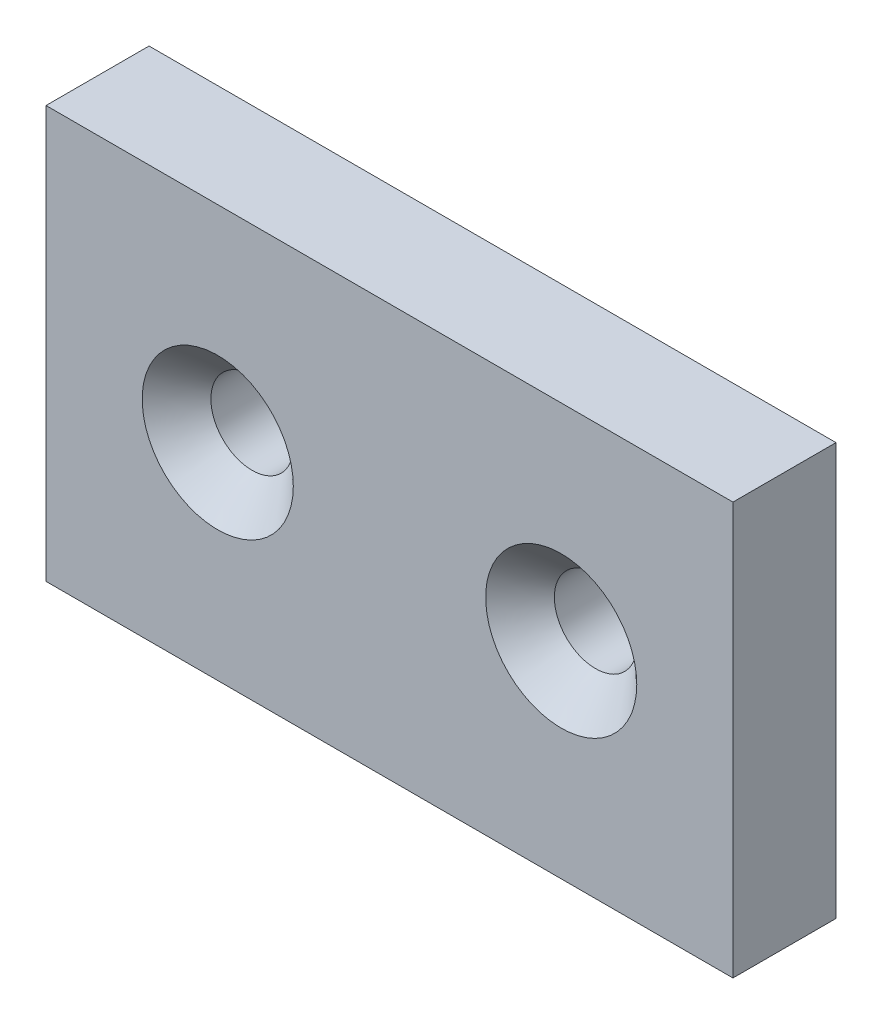
from build123d import *

# Parameters (mm, degrees)
SCHIZZO1_W                   = 20
SCHIZZO1_H                   = 19.7
ESTRUSIONE_ESTRUSIONE1_DEPTH = 3
SCHIZZO7_W                   = 20
SCHIZZO7_H                   = 3.85
TAGLIO_ESTRUSIONE1_DEPTH     = 10


# Read off the part's stored shape, not the designer's step: Foro svasato per Vite M2-2
with BuildPart() as part:
    # Schizzo1 → Estrusione-Estrusione1 (new body)
    with BuildSketch(Plane.XY):
        with Locations((10, 9.85)):
            Rectangle(SCHIZZO1_W, SCHIZZO1_H)
    extrude(amount=ESTRUSIONE_ESTRUSIONE1_DEPTH)

    # Foro svasato per Vite M2-2 outline → Foro svasato per Vite M2-2 (revolve, cut)
    with BuildSketch(Plane(origin=(15, 9.85, 0), x_dir=(1, 0, 0), z_dir=(0, -1, 0))):
        Polygon((0, 0), (1.2, 0), (1.2, 2), (2.2, 3), (0, 3), align=None)
    revolve(axis=Axis((15, 9.85, 0), (0, 0, 1)), mode=Mode.SUBTRACT)

    # Foro svasato per Vite M2-2 2 outline → Foro svasato per Vite M2-2 2 (revolve, cut)
    with BuildSketch(Plane(origin=(5, 9.85, 0), x_dir=(1, 0, 0), z_dir=(0, -1, 0))):
        Polygon((0, 0), (1.2, 0), (1.2, 2), (2.2, 3), (0, 3), align=None)
    revolve(axis=Axis((5, 9.85, 0), (0, 0, 1)), mode=Mode.SUBTRACT)

    # Schizzo7 → Taglio-Estrusione1 (cut)
    with BuildSketch(Plane(origin=(0, 0, 0), x_dir=(-1, 0, 0), z_dir=(0, 0, -1))):
        with Locations((-10, 17.775)):
            Rectangle(SCHIZZO7_W, SCHIZZO7_H)
        with Locations((-10, 1.925)):
            Rectangle(SCHIZZO7_W, SCHIZZO7_H)
    extrude(amount=-TAGLIO_ESTRUSIONE1_DEPTH, mode=Mode.SUBTRACT)


solid = part.part
